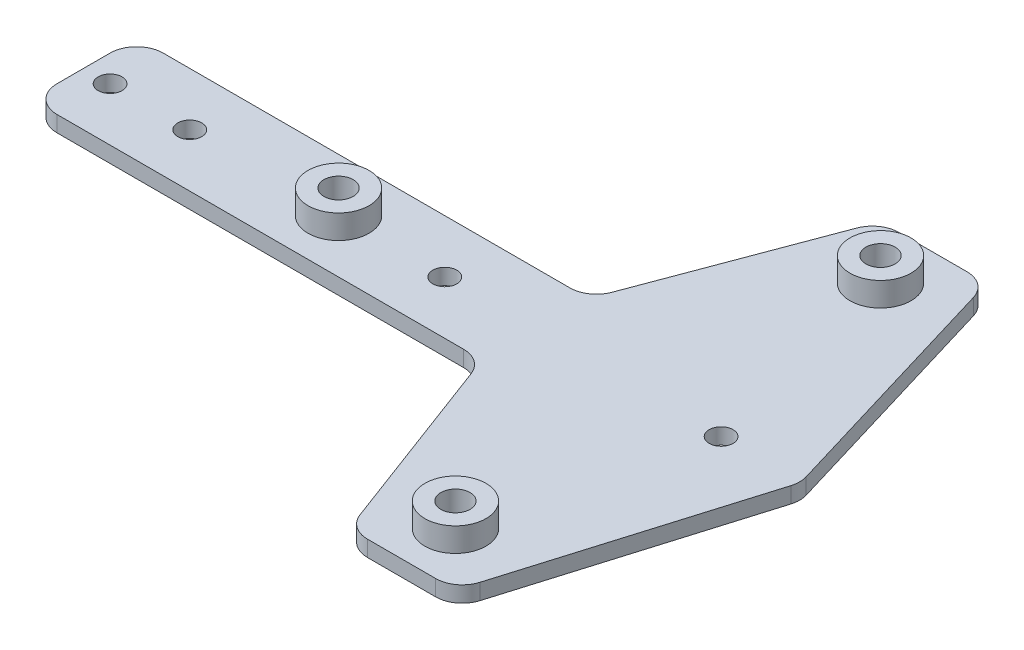
from build123d import *

# Parameters (mm, degrees)
BOSS_EXTRUDE1_DEPTH = 3
SKETCH2_R           = 2.75
CUT_EXTRUDE1_DEPTH  = 79.160092119
BOSS_EXTRUDE2_START = 4.5
SKETCH3_R           = 5.75
SKETCH3_R_2         = 2.75
BOSS_EXTRUDE2_DEPTH = 4.5
SKETCH4_R           = 2.25
CUT_EXTRUDE2_DEPTH  = 79.23202669
SKETCH5_R           = 2.25
BOSS_EXTRUDE3_DEPTH = 3
SKETCH6_R           = 2.25
CUT_EXTRUDE3_DEPTH  = 91.251038775


with BuildPart() as part:
    # Sketch1 → Boss-Extrude1 (new body)
    with BuildSketch(Plane(origin=(0, 0, 0), x_dir=(1, 0, 0), z_dir=(0, 1, 0))):
        with BuildLine():
            Line((-55, 10), (6.534997659, 10))
            ThreePointArc((6.534997659, 10), (9.382971848, 10.890371912), (11.216643547, 13.244382792))
            Line((11.216643547, 13.244382792), (23.783356453, 46.755617208))
            ThreePointArc((23.783356453, 46.755617208), (25.617028152, 49.109628088), (28.465002341, 50))
            Line((28.465002341, 50), (41.279846746, 50))
            ThreePointArc((41.279846746, 50), (44.264499394, 49.011464641), (46.068978172, 46.436739428))
            Line((46.068978172, 46.436739428), (59.568978172, 1.436739428))
            ThreePointArc((59.568978172, 1.436739428), (59.779846746, 0), (59.568978172, -1.436739428))
            Line((59.568978172, -1.436739428), (46.068978172, -46.436739428))
            ThreePointArc((46.068978172, -46.436739428), (44.264499394, -49.011464641), (41.279846746, -50))
            Line((41.279846746, -50), (28.465002341, -50))
            ThreePointArc((28.465002341, -50), (25.617028152, -49.109628088), (23.783356453, -46.755617208))
            Line((23.783356453, -46.755617208), (11.216643547, -13.244382792))
            ThreePointArc((11.216643547, -13.244382792), (9.382971848, -10.890371912), (6.534997659, -10))
            Line((6.534997659, -10), (-55, -10))
            ThreePointArc((-55, -10), (-58.535533906, -8.535533906), (-60, -5))
            Line((-60, -5), (-60, 5))
            ThreePointArc((-60, 5), (-58.535533906, 8.535533906), (-55, 10))
        make_face()
    extrude(amount=BOSS_EXTRUDE1_DEPTH)

    # Sketch2 → Cut-Extrude1 (cut, through all)
    with BuildSketch(Plane(origin=(0, 3, 0), x_dir=(1, 0, 0), z_dir=(0, 1, 0))):
        with Locations((-27, 0)):
            Circle(SKETCH2_R)
        with Locations((35, 40)):
            Circle(SKETCH2_R)
        with Locations((35, -40)):
            Circle(SKETCH2_R)
    extrude(amount=-CUT_EXTRUDE1_DEPTH, mode=Mode.SUBTRACT)

    # Sketch3 → Boss-Extrude2 (add)
    # profile 1 of 3: a face of its own
    with BuildSketch(Plane(origin=(0, 3, 0), x_dir=(1, 0, 0), z_dir=(0, 1, 0)).offset(BOSS_EXTRUDE2_START)):
        with Locations((-27, 0)):
            Circle(SKETCH3_R)
        with Locations((-27, 0)):
            Circle(SKETCH3_R_2, mode=Mode.SUBTRACT)
    # profile 2 of 3: a face of its own
    with BuildSketch(Plane(origin=(0, 3, 0), x_dir=(1, 0, 0), z_dir=(0, 1, 0)).offset(BOSS_EXTRUDE2_START)):
        with Locations((35, 40)):
            Circle(SKETCH3_R)
        with Locations((35, 40)):
            Circle(SKETCH3_R_2, mode=Mode.SUBTRACT)
    # profile 3 of 3: a face of its own
    with BuildSketch(Plane(origin=(0, 3, 0), x_dir=(1, 0, 0), z_dir=(0, 1, 0)).offset(BOSS_EXTRUDE2_START)):
        with Locations((35, -40)):
            Circle(SKETCH3_R)
        with Locations((35, -40)):
            Circle(SKETCH3_R_2, mode=Mode.SUBTRACT)
    extrude(amount=-BOSS_EXTRUDE2_DEPTH)

    # Sketch4 → Cut-Extrude2 (cut, through all)
    with BuildSketch(Plane(origin=(0, 3, 0), x_dir=(1, 0, 0), z_dir=(0, 1, 0))):
        with Locations((-55, 0)):
            Circle(SKETCH4_R)
        with Locations((45, 0)):
            Circle(SKETCH4_R)
        with Locations((-7, 0)):
            Circle(SKETCH4_R)
    extrude(amount=-CUT_EXTRUDE2_DEPTH, mode=Mode.SUBTRACT)

    # Sketch5 → Boss-Extrude3 (add)
    with BuildSketch(Plane(origin=(0, 0, 0), x_dir=(1, 0, 0), z_dir=(0, 1, 0))):
        with BuildLine():
            Line((-55, 10), (-70, 10))
            ThreePointArc((-70, 10), (-73.535533906, 8.535533906), (-75, 5))
            Line((-75, 5), (-75, -5))
            ThreePointArc((-75, -5), (-73.535533906, -8.535533906), (-70, -10))
            Line((-70, -10), (-55, -10))
            Line((-55, -10), (-55, 10))
        make_face()
        with Locations((-70, 0)):
            Circle(SKETCH5_R, mode=Mode.SUBTRACT)
    extrude(amount=BOSS_EXTRUDE3_DEPTH)

    # Sketch6 → Cut-Extrude3 (cut, through all)
    with BuildSketch(Plane(origin=(0, 3, 0), x_dir=(1, 0, 0), z_dir=(0, 1, 0))):
        with Locations((-55, 0)):
            Circle(SKETCH6_R)
    extrude(amount=-CUT_EXTRUDE3_DEPTH, mode=Mode.SUBTRACT)


solid = part.part
